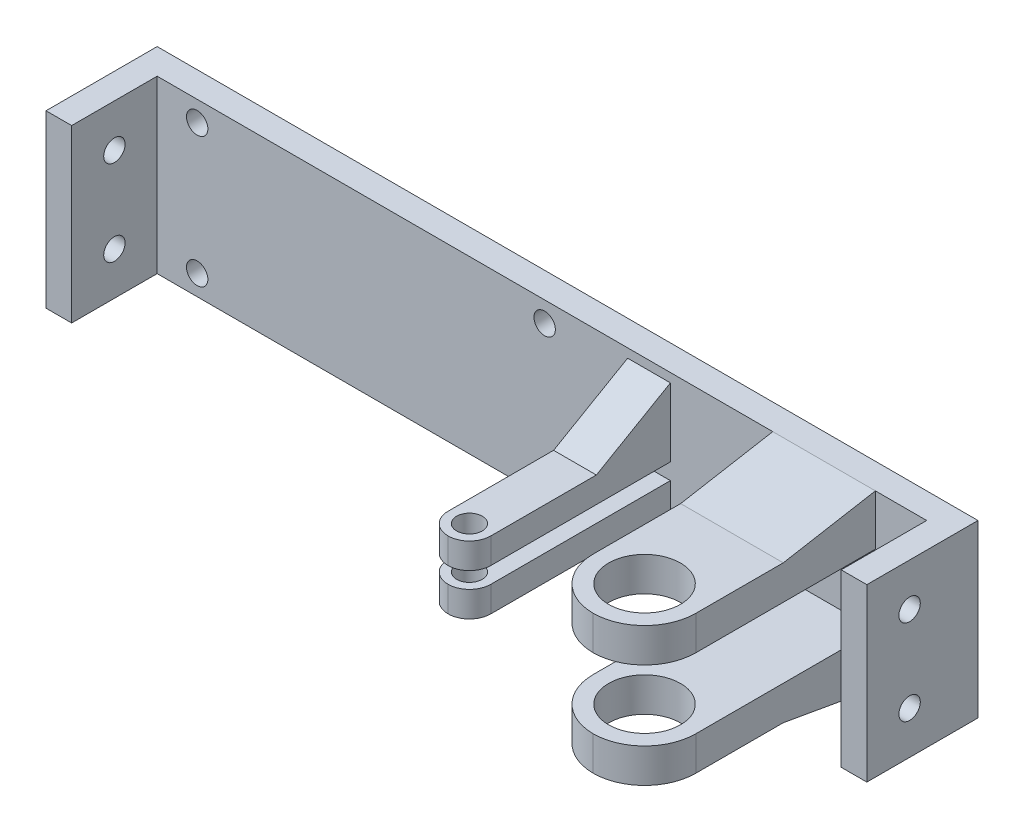
from build123d import *
from OCP.BRepFilletAPI import BRepFilletAPI_MakeChamfer

# Parameters (mm, degrees)
SCHIZZO1_W                   = 96
SCHIZZO1_H                   = 20
SCHIZZO1_R                   = 1
SCHIZZO1_R_2                 = 1.25
ESTRUSIONE_ESTRUSIONE1_DEPTH = 3
SCHIZZO2_W                   = 3
SCHIZZO2_H                   = 20
ESTRUSIONE_ESTRUSIONE2_DEPTH = 10
SCHIZZO3_R                   = 1.25
TAGLIO_ESTRUSIONE1_DEPTH     = 98.390964673
SCHIZZO4_W                   = 12
SCHIZZO4_H                   = 4
ESTRUSIONE_ESTRUSIONE3_DEPTH = 27
RACCORDO1_R                  = 6
SCHIZZO5_R                   = 4.2
TAGLIO_ESTRUSIONE2_DEPTH     = 60.427350606
SMUSSO1_SIZE                 = 10.775435457
SMUSSO1_SIZE_2               = 1.9
SCHIZZO6_W                   = 5
SCHIZZO6_H                   = 3
ESTRUSIONE_ESTRUSIONE4_DEPTH = 23.5
RACCORDO2_R                  = 2.5
SCHIZZO7_R                   = 1.5
TAGLIO_ESTRUSIONE3_DEPTH     = 59.297534253
SMUSSO2_SIZE                 = 5
SMUSSO2_SIZE2                = 8.660254038


with BuildPart() as part:
    # Schizzo1 → Estrusione-Estrusione1 (new body)
    with BuildSketch(Plane.XY):
        Rectangle(SCHIZZO1_W, SCHIZZO1_H)
        with Locations((20.125, 0)):
            Circle(SCHIZZO1_R, mode=Mode.SUBTRACT)
        with Locations((-40.32, 7.62)):
            Circle(SCHIZZO1_R_2, mode=Mode.SUBTRACT)
        with Locations((0.32, 7.62)):
            Circle(SCHIZZO1_R_2, mode=Mode.SUBTRACT)
        with Locations((0.32, -7.62)):
            Circle(SCHIZZO1_R_2, mode=Mode.SUBTRACT)
        with Locations((-40.32, -7.62)):
            Circle(SCHIZZO1_R_2, mode=Mode.SUBTRACT)
    extrude(amount=ESTRUSIONE_ESTRUSIONE1_DEPTH)

    # Schizzo2 → Estrusione-Estrusione2 (add)
    with BuildSketch(Plane.XY.offset(3)):
        with Locations((-46.5, 0)):
            Rectangle(SCHIZZO2_W, SCHIZZO2_H)
        with Locations((46.5, 0)):
            Rectangle(SCHIZZO2_W, SCHIZZO2_H)
    extrude(amount=ESTRUSIONE_ESTRUSIONE2_DEPTH)

    # Schizzo3 → Taglio-Estrusione1 (cut, through all)
    with BuildSketch(Plane.ZY.offset(48)):
        with Locations((8, -5)):
            Circle(SCHIZZO3_R)
        with Locations((8, 5)):
            Circle(SCHIZZO3_R)
    extrude(amount=-TAGLIO_ESTRUSIONE1_DEPTH, mode=Mode.SUBTRACT)

    # Schizzo4 → Estrusione-Estrusione3 (add)
    with BuildSketch(Plane.XY.offset(3)):
        with Locations((33, -6.1)):
            Rectangle(SCHIZZO4_W, SCHIZZO4_H)
        with Locations((33, 6.1)):
            Rectangle(SCHIZZO4_W, SCHIZZO4_H)
    extrude(amount=ESTRUSIONE_ESTRUSIONE3_DEPTH)

    # Raccordo1
    raccordo1_edges = [part.edges().sort_by_distance(p)[0] for p in [
        (27, 6.1, 30),
        (39, 6.1, 30),
        (39, -6.1, 30),
        (27, -6.1, 30),
    ]]
    fillet(raccordo1_edges, radius=RACCORDO1_R - 0.0001)  # a hair under: the kernel refuses the full size

    # Schizzo5 → Taglio-Estrusione2 (cut, through all)
    with BuildSketch(Plane(origin=(0, 8.1, 0), x_dir=(1, 0, 0), z_dir=(0, 1, 0))):
        with Locations(Location((33, -24, 0), (0, 0, 180))):
            Circle(SCHIZZO5_R)
    extrude(amount=-TAGLIO_ESTRUSIONE2_DEPTH, mode=Mode.SUBTRACT)

    # Smusso1
    smusso1_edges_1 = [part.edges().sort_by_distance(p)[0] for p in [
        (33, -8.1, 3),
    ]]
    smusso1_side_1 = [part.faces().sort_by_distance(p)[0] for p in [
        (33, -8.1, 3.038),
    ]]
    smusso1_edges_2 = [part.edges().sort_by_distance(p)[0] for p in [
        (33, 8.1, 3),
    ]]
    smusso1_side_2 = [part.faces().sort_by_distance(p)[0] for p in [
        (33, 8.138, 3),
    ]]
    smusso1 = BRepFilletAPI_MakeChamfer(part.part.solid().wrapped)
    for e in smusso1_edges_1:
        smusso1.Add(SMUSSO1_SIZE - 0.0001, SMUSSO1_SIZE_2 - 0.0001, e.wrapped, smusso1_side_1[0].wrapped)
    for e in smusso1_edges_2:
        smusso1.Add(SMUSSO1_SIZE_2 - 0.0001, SMUSSO1_SIZE - 0.0001, e.wrapped, smusso1_side_2[0].wrapped)
    add(Compound.cast(smusso1.Shape()), mode=Mode.REPLACE)  # a hair under: the kernel refuses the full size

    # Schizzo6 → Estrusione-Estrusione4 (add)
    with BuildSketch(Plane.XY.offset(3)):
        with Locations((12.525, 2.45)):
            Rectangle(SCHIZZO6_W, SCHIZZO6_H)
        with Locations((12.525, -2.45)):
            Rectangle(SCHIZZO6_W, SCHIZZO6_H)
    extrude(amount=ESTRUSIONE_ESTRUSIONE4_DEPTH)

    # Raccordo2
    raccordo2_edges = [part.edges().sort_by_distance(p)[0] for p in [
        (15.025, -2.45, 26.5),
        (10.025, -2.45, 26.5),
        (15.025, 2.45, 26.5),
        (10.025, 2.45, 26.5),
    ]]
    fillet(raccordo2_edges, radius=RACCORDO2_R - 0.0001)  # a hair under: the kernel refuses the full size

    # Schizzo7 → Taglio-Estrusione3 (cut, through all)
    with BuildSketch(Plane(origin=(0, 3.95, 0), x_dir=(1, 0, 0), z_dir=(0, 1, 0))):
        with Locations(Location((12.525, -24, 0), (0, 0, 180))):
            Circle(SCHIZZO7_R)
    extrude(amount=-TAGLIO_ESTRUSIONE3_DEPTH, mode=Mode.SUBTRACT)

    # Smusso2
    smusso2_edges = [part.edges().sort_by_distance(p)[0] for p in [
        (12.525, 3.95, 3),
        (12.525, -3.95, 3),
    ]]
    smusso2_side = [part.faces().sort_by_distance(p)[0] for p in [
        (-2.939038544, 0, 3),
    ]]
    chamfer(smusso2_edges, length=SMUSSO2_SIZE, length2=SMUSSO2_SIZE2, reference=smusso2_side[0])


solid = part.part
